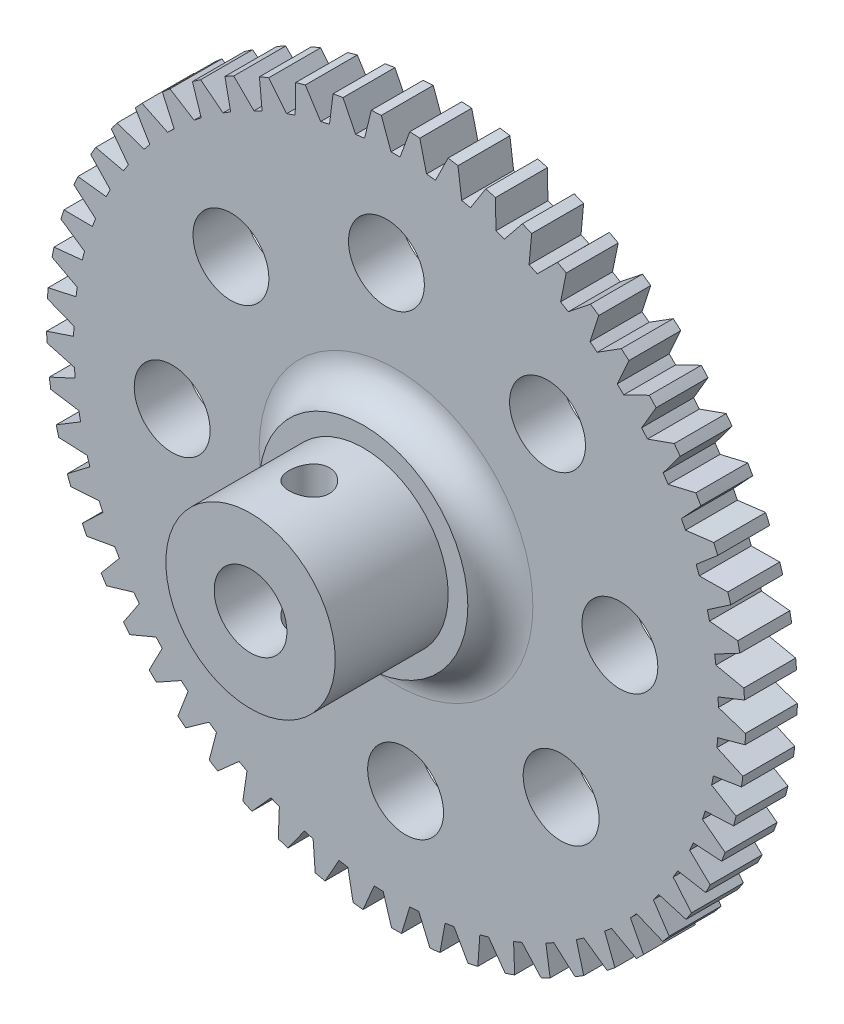
from build123d import *

# Parameters (mm, degrees)
SKETCH1_R                       = 19.645
EXTRUDE1_DEPTH                  = 2.921
CUT_EXTRUDE1_DEPTH              = 28.935359153
CIRPATTERN1_COUNT               = 57
SKETCH4_R                       = 5.8674
EXTRUDE2_DEPTH                  = 1.8288
FILLET1_R                       = 1.8288
FILLET2_R                       = 1.8288
SKETCH5_R                       = 3.9116
CUT_EXTRUDE3_DEPTH              = 29.549551428
SKETCH7_R                       = 2.1336
CUT_EXTRUDE4_DEPTH              = 2.921
CIRPATTERN2_COUNT               = 8
SKETCH8_R                       = 4.7625
SKETCH8_R_2                     = 2.045
BOSS_EXTRUDE1_DEPTH             = 6.35
BOSS_EXTRUDE1_DIRECTION_2_REACH = 30.55
F_4_40_TAPPED_HOLE1_D           = 2.2606


with BuildPart() as part:
    # Sketch1 → Extrude1 (new body)
    with BuildSketch(Plane.XY):
        Circle(SKETCH1_R)
    extrude(amount=EXTRUDE1_DEPTH)

    # Sketch3 → Cut-Extrude1 (cut, through all)
    with BuildSketch(Plane(origin=(0, 0, 0), x_dir=(-1, 0, 0), z_dir=(0, 0, -1))):
        with BuildLine():
            Line((0.718627089, -18.112096409), (0.254, -19.643357885))
            ThreePointArc((0.254, -19.643357885), (1.05382237, -19.616714389), (1.851895972, -19.557517897))
            Line((1.851895972, -19.557517897), (1.225895651, -18.084845619))
            ThreePointArc((1.225895651, -18.084845619), (0.97235684, -18.100248158), (0.718627089, -18.112096409))
        make_face()
    cut_extrude1 = extrude(amount=-CUT_EXTRUDE1_DEPTH, mode=Mode.SUBTRACT)

    # CirPattern1: Cut-Extrude1 ×57 about axis
    cirpattern1_axis = Axis((0, 0, 0), (0, 0, 1))
    for i in range(1, CIRPATTERN1_COUNT):
        add(cut_extrude1.rotate(cirpattern1_axis, i * 360 / CIRPATTERN1_COUNT), mode=Mode.SUBTRACT)

    # Sketch4 → Extrude2 (add)
    with BuildSketch(Plane(origin=(0, 0, 0), x_dir=(-1, 0, 0), z_dir=(0, 0, -1))):
        with Locations(Location((0, 0, 0), (0, 0, 180))):
            Circle(SKETCH4_R)
    extrude2 = extrude(amount=EXTRUDE2_DEPTH)

    # Fillet1
    fillet1_edges = [part.edges().sort_by_distance(p)[0] for p in [
        (-5.8674, 0, 0),
    ]]
    fillet(fillet1_edges, radius=FILLET1_R - 0.0001)  # a hair under: the kernel refuses the full size

    # Mirror3: Extrude2 across plane
    add(extrude2.mirror(Plane(origin=(0, 0, 1.4605), x_dir=(1, 0, 0), z_dir=(0, 0, -1))))

    # Fillet2
    fillet2_edges = [part.edges().sort_by_distance(p)[0] for p in [
        (-5.8674, 0, 2.921),
    ]]
    fillet(fillet2_edges, radius=FILLET2_R - 0.0001)  # a hair under: the kernel refuses the full size

    # Sketch5 → Cut-Extrude3 (cut, through all)
    with BuildSketch(Plane(origin=(0, 0, -1.8288), x_dir=(-1, 0, 0), z_dir=(0, 0, -1))):
        Circle(SKETCH5_R)
    extrude(amount=-CUT_EXTRUDE3_DEPTH, mode=Mode.SUBTRACT)

    # Sketch7 → Cut-Extrude4 (cut)
    with BuildSketch(Plane.XY.offset(2.921)):
        with Locations((-9.281277877, 8.519246653)):
            Circle(SKETCH7_R)
    cut_extrude4 = extrude(amount=-CUT_EXTRUDE4_DEPTH, mode=Mode.SUBTRACT)

    # CirPattern2: Cut-Extrude4 ×8 about axis
    cirpattern2_axis = Axis((0, 0, 0), (0, 0, 1))
    for i in range(1, CIRPATTERN2_COUNT):
        add(cut_extrude4.rotate(cirpattern2_axis, i * 360 / CIRPATTERN2_COUNT), mode=Mode.SUBTRACT)

    # Sketch8 → Boss-Extrude1 (add)
    with BuildSketch(Plane.XY.offset(4.7498)):
        Circle(SKETCH8_R)
        Circle(SKETCH8_R_2, mode=Mode.SUBTRACT)
    extrude(amount=BOSS_EXTRUDE1_DEPTH)

    # Boss-Extrude1 direction 2: up to this face of the body (flat: up to its plane)
    boss_extrude1_direction_2_end = Plane(part.part.faces().sort_by_distance((-5.701444867, 0, -1.8288))[0])
    # Sketch8 → Boss-Extrude1 direction 2 (add, up to the picked face)
    with BuildSketch(Plane.XY.offset(4.7498), mode=Mode.PRIVATE) as boss_extrude1_direction_2_sk1:
        Circle(SKETCH8_R)
        Circle(SKETCH8_R_2, mode=Mode.SUBTRACT)
    boss_extrude1_direction_2_tool1 = split(extrude(boss_extrude1_direction_2_sk1.sketch, amount=-BOSS_EXTRUDE1_DIRECTION_2_REACH, mode=Mode.PRIVATE), bisect_by=boss_extrude1_direction_2_end, keep=Keep.BOTH, mode=Mode.PRIVATE)
    add(boss_extrude1_direction_2_tool1.solids().sort_by(Axis((-4.627796, 0, 4.7498), (0, 0, -1)))[0])

    # #4-40 Tapped Hole1 (through all)
    with Locations(Plane(origin=(0, 4.7625, 7.7978), x_dir=(1, 0, 0), z_dir=(0, 1, 0))):
        with Locations((0, 0)):
            Hole(F_4_40_TAPPED_HOLE1_D / 2)


solid = part.part
